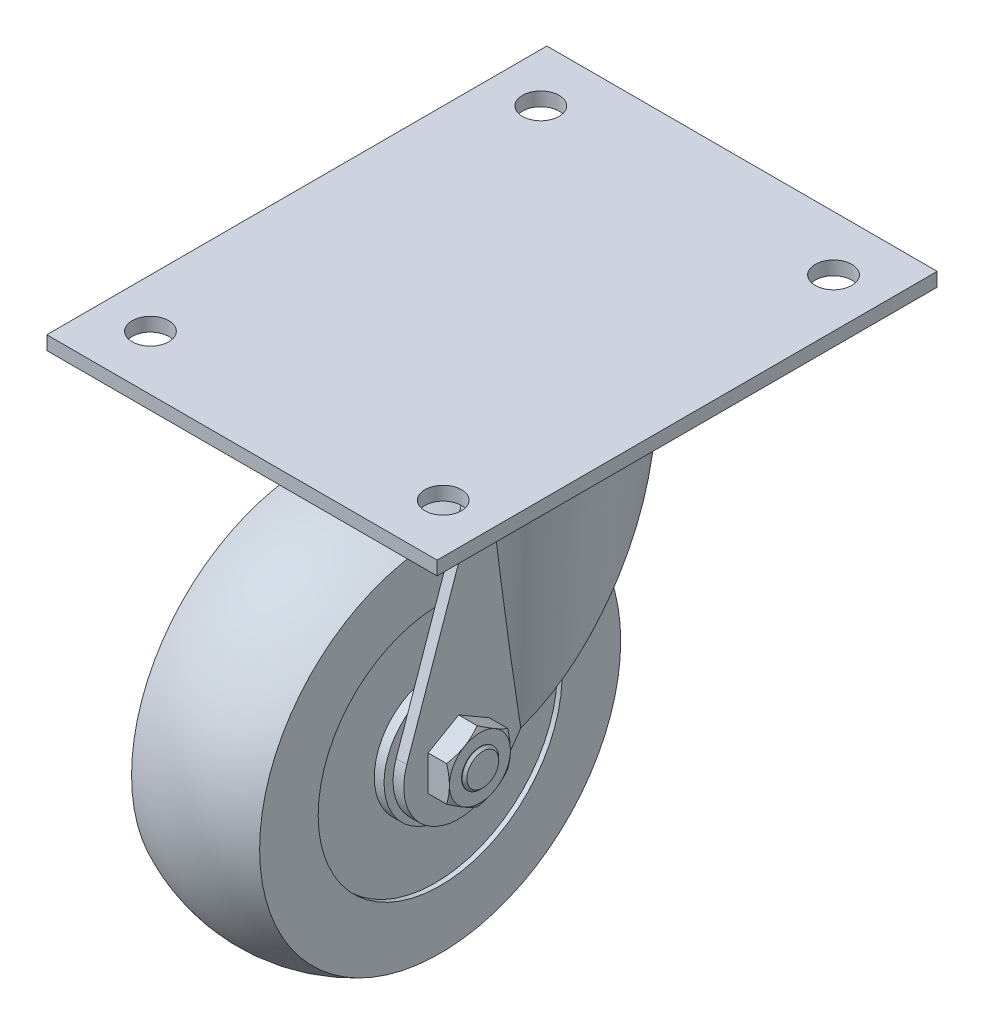
from build123d import *

# Parameters (mm, degrees)
SKETCH3_W                   = 101.6
SKETCH3_H                   = 130.175
SKETCH3_R                   = 4.7625
EXTRUDE1_DEPTH              = 3.571875
SKETCH9_R                   = 31.3928125
EXTRUDE7_DEPTH              = 3.9624
FILLET2_R                   = 1.778
SKETCH4_R                   = 31.3928125
EXTRUDE2_DEPTH              = 4.7625
FILLET3_R                   = 1.778
SKETCH14_R                  = 31.3928125
EXTRUDE13_DEPTH             = 78.190725
EXTRUDE13_TAPER             = 5
EXTRUDE13_OTHER_WAY_DEPTH   = 5.08
EXTRUDE14_DEPTH             = 21.478875
SHELL1_START                = 59.5376
SHELL1_DEPTH                = 6.6675
SHELL1_START_2              = -18.70075
SHELL1_4_DEPTH              = 37.4015
SKETCH44_R                  = 61.958083024
CUT_EXTRUDE4_DEPTH          = 5.08
CUT_EXTRUDE1_DEPTH          = 133.134940496
CUT_EXTRUDE1_DEPTH_BACK     = 133.134940496
SKETCH45_W                  = 37.4015
SKETCH45_H                  = 10.116972476
CUT_EXTRUDE5_DEPTH          = 2.778125
EXTRUDE27_REACH             = 134.135
SKETCH23_R                  = 4.7625
EXTRUDE27_DIRECTION_2_REACH = 134.135
EXTRUDE28_DEPTH             = 5.5372
SKETCH37_OUTSIDE_W          = 696.444
SKETCH37_OUTSIDE_H          = 677.394
SKETCH37_OUTSIDE_R          = 7.9375
EXTRUDE42_DEPTH             = 145.687055497
EXTRUDE42_DRAFT             = -60
SKETCH25_R                  = 4.7625
EXTRUDE29_DEPTH             = 0.762
CHAMFER1_SIZE               = 0.635


with BuildPart() as part:
    # Sketch1 → Revolve1 (revolve)
    with BuildSketch(Plane.XY, mode=Mode.PRIVATE) as revolve1_sk:
        with BuildLine():
            Line((-17.93875, 0), (-17.93875, 15.875))
            Line((-17.93875, 15.875), (-15.39875, 15.875))
            Line((-15.39875, 15.875), (-15.39875, 31.75))
            Line((-15.39875, 31.75), (-16.66875, 31.75))
            Line((-16.66875, 31.75), (-16.66875, 46.99))
            ThreePointArc((-16.66875, 46.99), (0, 50.8), (16.66875, 46.99))
            Line((16.66875, 46.99), (16.66875, 31.75))
            Line((16.66875, 31.75), (15.39875, 31.75))
            Line((15.39875, 31.75), (15.39875, 15.875))
            Line((15.39875, 15.875), (17.93875, 15.875))
            Line((17.93875, 15.875), (17.93875, 0))
            Line((17.93875, 0), (-17.93875, 0))
        make_face()
    revolve(revolve1_sk.sketch.rotate(Axis((-37.852772957, 0, 0), (1, 0, 0)), 90), axis=Axis((-37.852772957, 0, 0), (1, 0, 0)))


with BuildPart() as body_2:
    # Sketch3 → Extrude1 (new body)
    with BuildSketch(Plane(origin=(0, 76.2, 0), x_dir=(-1, 0, 0), z_dir=(0, 1, 0))):
        with Locations((0, -30.1625)):
            Rectangle(SKETCH3_W, SKETCH3_H)
        with Locations(Location((38.1, 20.6375, 0), (0, 0, 90))):
            Circle(SKETCH3_R, mode=Mode.SUBTRACT)
        with Locations(Location((38.1, -80.9625, 0), (0, 0, 90))):
            Circle(SKETCH3_R, mode=Mode.SUBTRACT)
        with Locations(Location((-38.1, 20.6375, 0), (0, 0, 90))):
            Circle(SKETCH3_R, mode=Mode.SUBTRACT)
        with Locations(Location((-38.1, -80.9625, 0), (0, 0, 90))):
            Circle(SKETCH3_R, mode=Mode.SUBTRACT)
    extrude(amount=-EXTRUDE1_DEPTH)

    # Sketch9 → Extrude7 (add)
    with BuildSketch(Plane.XZ.offset(-72.628125)):
        with Locations(Location((0, -30.1625, 0), (0, 0, 270))):
            Circle(SKETCH9_R)
    extrude(amount=EXTRUDE7_DEPTH)

    # Fillet2
    fillet2_edges = [body_2.edges().sort_by_distance(p)[0] for p in [
        (0, 68.665725, 1.2303125),
    ]]
    fillet(fillet2_edges, radius=FILLET2_R)


with BuildPart() as body_3:
    # Sketch4 → Extrude2 (new body)
    with BuildSketch(Plane(origin=(0, 68.665725, 0), x_dir=(-1, 0, 0), z_dir=(0, 1, 0))):
        with Locations(Location((0, -30.1625, 0), (0, 0, 270))):
            Circle(SKETCH4_R)
    extrude(amount=-EXTRUDE2_DEPTH)

    # Fillet3
    fillet3_edges = [body_3.edges().sort_by_distance(p)[0] for p in [
        (0, 68.665725, 1.2303125),
    ]]
    fillet(fillet3_edges, radius=FILLET3_R)


with BuildPart() as body_4:
    # Sketch14 → Extrude13 (new body)
    with BuildSketch(Plane.XZ.offset(-63.903225)):
        with Locations(Location((0, -30.1625, 0), (0, 0, 270))):
            Circle(SKETCH14_R)
    extrude(amount=EXTRUDE13_DEPTH, taper=EXTRUDE13_TAPER)

    # Sketch14 → Extrude13 other way (add)
    with BuildSketch(Plane.XZ.offset(-63.903225)):
        with Locations(Location((0, -30.1625, 0), (0, 0, 270))):
            Circle(SKETCH14_R)
    extrude(amount=-EXTRUDE13_OTHER_WAY_DEPTH)

    # Sketch15 → Extrude14 (add, symmetric)
    with BuildSketch(Plane(origin=(0, 0, 0), x_dir=(0, 0, -1), z_dir=(1, 0, 0))):
        Polygon((-33.943962099, -17.065625), (30.1625, -17.065625), (30.1625, 62.315725), (-6.3103125, 62.315725), align=None)
    extrude(amount=EXTRUDE14_DEPTH, both=True)

    # Shell1: read off the stored shape, not the designer's step
    # Shell1 outline → Shell1 (cut)
    with BuildSketch(Plane(origin=(0, 0, 0), x_dir=(1, 0, 0), z_dir=(0, 1, 0)).offset(SHELL1_START)):
        with BuildLine():
            ThreePointArc((18.70075, 8.504192352), (0, 58.7771875), (-18.70075, 8.504192352))
            ThreePointArc((-18.70075, 8.504192352), (0, 1.5478125), (18.70075, 8.504192352))
        make_face()
    extrude(amount=SHELL1_DEPTH, mode=Mode.SUBTRACT)

    # Shell1 2 outline → Shell1 2 (revolve, cut)
    with BuildSketch(Plane.XY.offset(-30.1625)):
        Polygon((0, 59.5376), (0, -14.2875), (21.763273483, -14.2875), (28.222132817, 59.5376), align=None)
    revolve(axis=Axis((0, 0, -30.1625), (0, 1, 0)), mode=Mode.SUBTRACT)

    # Shell1 3 outline → Shell1 3 (revolve)
    with BuildSketch(Plane.XY.offset(-30.1625)):
        Polygon((28.6146875, 64.024520557), (28.222132817, 59.5376), (28.6146875, 59.5376), align=None)
    revolve(axis=Axis((0, 0, -30.1625), (0, 1, 0)))

    # Shell1 4 outline → Shell1 4 (cut)
    with BuildSketch(Plane.YZ.offset(SHELL1_START_2)):
        Polygon((59.5376, 4.335770191), (-14.2875, 30.035219054), (-14.2875, -21), (59.5376, -21), align=None)
    extrude(amount=SHELL1_4_DEPTH, mode=Mode.SUBTRACT)

    # Sketch44 → Cut-Extrude4 (cut)
    with BuildSketch(Plane(origin=(0, 68.983225, 0), x_dir=(1, 0, 0), z_dir=(0, 1, 0))):
        with Locations((0, 30.1625)):
            Circle(SKETCH44_R)
    extrude(amount=-CUT_EXTRUDE4_DEPTH, mode=Mode.SUBTRACT)

    # Sketch41 → Cut-Extrude1 (cut, two sides: drawn at the far end of the back side and taken through both)
    with BuildSketch(Plane(origin=(0, 0, 0), x_dir=(0, 0, -1), z_dir=(1, 0, 0)).offset(-CUT_EXTRUDE1_DEPTH_BACK)):
        with BuildLine():
            Line((11.666248345, -8.248109226), (61.396810357, 62.091537211))
            Line((61.396810357, 62.091537211), (54.471456026, -17.065625))
            Line((54.471456026, -17.065625), (-33.943962099, -17.065625))
            Line((-33.943962099, -17.065625), (-33.943962099, 62.315725))
            Line((-33.943962099, 62.315725), (6.564442144, 62.315725))
            Line((6.564442144, 62.315725), (-13.493297895, 4.697187261))
            ThreePointArc((-13.493297895, 4.697187261), (-6.536796065, -12.704446208), (11.666248345, -8.248109226))
        make_face()
    extrude(amount=CUT_EXTRUDE1_DEPTH + CUT_EXTRUDE1_DEPTH_BACK, mode=Mode.SUBTRACT)

    # Sketch45 → Cut-Extrude5 (cut)
    with BuildSketch(Plane.XZ.offset(-59.5376)):
        with Locations((0, -3.967061991)):
            Rectangle(SKETCH45_W, SKETCH45_H)
    extrude(amount=-CUT_EXTRUDE5_DEPTH, mode=Mode.SUBTRACT)


with BuildPart() as body_5:

    # Extrude27: up to this face of the body (flat: up to its plane)
    extrude27_end = Plane(body_4.part.faces().sort_by_distance((21.478875, 14.443558801, -2.006371397))[0])
    # Sketch23 → Extrude27 (new, up to the picked face)
    with BuildSketch(Plane(origin=(0, 0, 0), x_dir=(0, 0, -1), z_dir=(1, 0, 0)), mode=Mode.PRIVATE) as extrude27_sk1:
        Circle(SKETCH23_R)
    extrude27_tool1 = split(extrude(extrude27_sk1.sketch, amount=EXTRUDE27_REACH, mode=Mode.PRIVATE), bisect_by=extrude27_end, keep=Keep.BOTH, mode=Mode.PRIVATE)
    add(extrude27_tool1.solids().sort_by(Axis((0, 0, 0), (1, 0, 0)))[0])


    # Extrude27 direction 2: up to this face of the body (flat: up to its plane)
    extrude27_direction_2_end = Plane(body_4.part.faces().sort_by_distance((-21.478875, 14.443558801, -2.006371397))[0])
    # Sketch23 → Extrude27 direction 2 (add, up to the picked face)
    with BuildSketch(Plane(origin=(0, 0, 0), x_dir=(0, 0, -1), z_dir=(1, 0, 0)), mode=Mode.PRIVATE) as extrude27_direction_2_sk1:
        Circle(SKETCH23_R)
    extrude27_direction_2_tool1 = split(extrude(extrude27_direction_2_sk1.sketch, amount=-EXTRUDE27_DIRECTION_2_REACH, mode=Mode.PRIVATE), bisect_by=extrude27_direction_2_end, keep=Keep.BOTH, mode=Mode.PRIVATE)
    add(extrude27_direction_2_tool1.solids().sort_by(Axis((0, 0, 0), (-1, 0, 0)))[0])


with BuildPart() as body_6:
    # Sketch24 → Extrude28 (new body)
    with BuildSketch(Plane(origin=(21.478875, 0, 0), x_dir=(0, 0, -1), z_dir=(1, 0, 0))):
        Polygon((0, 9.165435523), (-7.9375, 4.582717762), (-7.9375, -4.582717762), (0, -9.165435523), (7.9375, -4.582717762), (7.9375, 4.582717762), align=None)
    extrude(amount=EXTRUDE28_DEPTH)


with BuildPart() as extrude42_tool:
    # Sketch37 outside → Extrude42 (with draft: the straight prism first)
    with BuildSketch(Plane(origin=(27.016075, 0, 0), x_dir=(0, 0, -1), z_dir=(1, 0, 0))):
        with Locations((22.225, 12.7)):
            Rectangle(SKETCH37_OUTSIDE_W, SKETCH37_OUTSIDE_H)
        Circle(SKETCH37_OUTSIDE_R, mode=Mode.SUBTRACT)
    extrude(amount=-EXTRUDE42_DEPTH)
    # Extrude42: the draft: its side faces are tilted about the plane it starts from
    extrude42_sides = [extrude42_tool.faces().sort_by_distance(p)[0] for p in [
        (-45.827452749, -325.997, -22.225),
        (-45.827452749, 12.7, -370.447),
        (-45.827452749, 351.397, -22.225),
        (-45.827452749, 12.7, 325.997),
        (-45.827452749, 0, 7.9375),
    ]]
    draft(extrude42_sides, Plane(origin=(27.016075, 0, 0), x_dir=(0, 0, -1), z_dir=(1, 0, 0)), EXTRUDE42_DRAFT)


with BuildPart() as body_6_1:
    add(body_6.part)

    # Extrude42: cut by extrude42_tool
    add(extrude42_tool.part, mode=Mode.SUBTRACT)


with BuildPart() as body_7:
    # Mirror1: mirrored copy
    add(body_6_1.part.mirror(Plane(origin=(0, 0, 0), x_dir=(0, 0, 1), z_dir=(1, 0, 0))))


with BuildPart() as body_8:
    # Sketch25 → Extrude29 (new body)
    with BuildSketch(Plane(origin=(27.016075, 0, 0), x_dir=(0, 0, -1), z_dir=(1, 0, 0))):
        Circle(SKETCH25_R)
    extrude(amount=EXTRUDE29_DEPTH)

    # Chamfer1
    chamfer1_edges = [body_8.edges().sort_by_distance(p)[0] for p in [
        (27.778075, 0, 4.7625),
    ]]
    chamfer(chamfer1_edges, length=CHAMFER1_SIZE)

    # Combine4: union body 7, body 6, body 5, body 4, body 3, body 2
    add(body_7.part)
    add(body_6_1.part)
    add(body_5.part)
    add(body_4.part)
    add(body_3.part)
    add(body_2.part)


solid = Compound([part.part, body_8.part])
